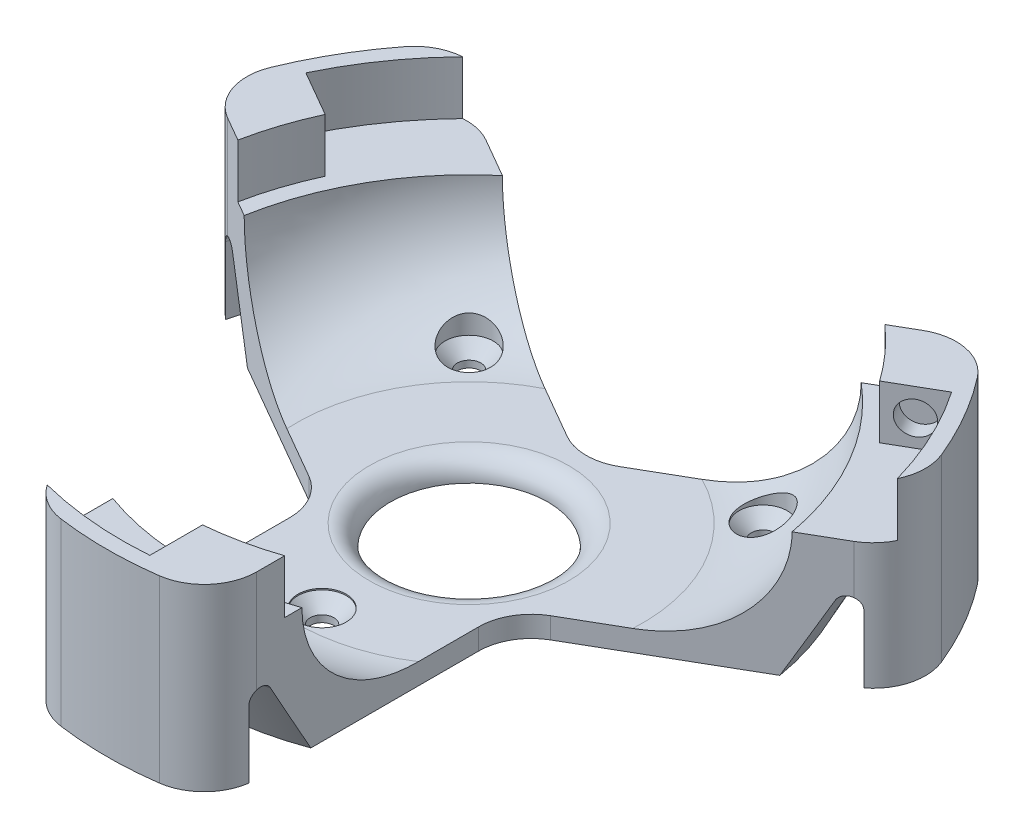
from build123d import *

# Parameters (mm, degrees)
SKETCH2_R                                      = 69
SKETCH2_R_2                                    = 53
BOSS_EXTRUDE1_DEPTH                            = 20
BOSS_EXTRUDE2_START                            = 4
SKETCH5_R                                      = 69
BOSS_EXTRUDE2_DEPTH                            = 4
CUT_EXTRUDE1_DEPTH                             = 101.488805371
CUT_EXTRUDE2_DEPTH                             = 10
CUT_EXTRUDE2_DEPTH_BACK                        = 0.25
SKETCH9_R                                      = 4.6
SKETCH15_R                                     = 15
CUT_EXTRUDE5_DEPTH                             = 12
FILLET1_R                                      = 10
FILLET2_R                                      = 10
FILLET4_R                                      = 4
CSK_FOR_M4_FLAT_HEAD_MACHINE_SCREW3_AT_2_COUNT = 2
CSK_FOR_M4_FLAT_HEAD_MACHINE_SCREW3_AT_2_PITCH = 62.60990337
CSK_FOR_M4_FLAT_HEAD_MACHINE_SCREW3_AT_3_COUNT = 2
CSK_FOR_M4_FLAT_HEAD_MACHINE_SCREW3_AT_3_PITCH = 62.60990337
BOSS_EXTRUDE3_DEPTH                            = 10.2
SKETCH17_R                                     = 3.1
CUT_EXTRUDE6_DEPTH                             = 3.1
CIRPATTERN1_COUNT                              = 3
FILLET5_R                                      = 2


with BuildPart() as part:
    # Sketch2 → Boss-Extrude1 (new body)
    with BuildSketch(Plane(origin=(0, 0, 0), x_dir=(1, 0, 0), z_dir=(0, 1, 0))):
        with Locations(Location((0, 0, 0), (0, 0, 270))):
            Circle(SKETCH2_R)
        with Locations(Location((0, 0, 0), (0, 0, 270))):
            Circle(SKETCH2_R_2, mode=Mode.SUBTRACT)
    extrude(amount=BOSS_EXTRUDE1_DEPTH)

    # Sketch4 → Revolve5 (revolve)
    with BuildSketch(Plane.XY):
        with BuildLine():
            Line((53, 20), (53, 0))
            Line((53, 0), (33, 0))
            add(Edge.make_bspline(
                [(33, 0), (53, 0), (53, 20)],
                knots=[4.71238898, 4.71238898, 4.71238898, 6.283185307, 6.283185307, 6.283185307], degree=2, weights=[1, 0.707106781, 1]))
        make_face()
    revolve(axis=Axis((0, 20, 0), (0, -1, 0)))

    # Sketch5 → Boss-Extrude2 (add)
    with BuildSketch(Plane.XZ.offset(BOSS_EXTRUDE2_START)):
        with Locations(Location((0, 0, 0), (0, 0, 270))):
            Circle(SKETCH5_R)
    extrude(amount=-BOSS_EXTRUDE2_DEPTH)

    # Sketch6 → Cut-Extrude1 (cut, through all)
    with BuildSketch(Plane.XZ.offset(4)):
        with BuildLine():
            Line((18, 10.392304845), (18, 58.283788484))
            Line((18, 58.283788484), (18, 89.35097408))
            ThreePointArc((18, 89.35097408), (78.934766908, 45.573008923), (86.380213406, -29.087029772))
            Line((86.380213406, -29.087029772), (59.475241456, -13.553436974))
            Line((59.475241456, -13.553436974), (18, 10.392304845))
        make_face()
        with BuildLine():
            Line((-59.475241456, -13.553436974), (-86.380213406, -29.087029772))
            ThreePointArc((-86.380213406, -29.087029772), (-78.934766908, 45.573008923), (-18, 89.35097408))
            Line((-18, 89.35097408), (-18, 58.283788484))
            Line((-18, 58.283788484), (-18, 10.392304845))
            Line((-18, 10.392304845), (-59.475241456, -13.553436974))
        make_face()
        with BuildLine():
            Line((0, -20.784609691), (41.475241456, -44.73035151))
            Line((41.475241456, -44.73035151), (68.380213406, -60.263944308))
            ThreePointArc((68.380213406, -60.263944308), (0, -91.146017845), (-68.380213406, -60.263944308))
            Line((-68.380213406, -60.263944308), (-41.475241456, -44.73035151))
            Line((-41.475241456, -44.73035151), (0, -20.784609691))
        make_face()
    extrude(amount=-CUT_EXTRUDE1_DEPTH, mode=Mode.SUBTRACT)

    # Sketch9 → Cut-Extrude2 (cut, two sides: drawn at the far end of the back side and taken through both)
    with BuildSketch(Plane(origin=(0, 0, 0), x_dir=(1, 0, 0), z_dir=(0, 1, 0)).offset(-CUT_EXTRUDE2_DEPTH_BACK)):
        with Locations(Location((0, -28, 0), (0, 0, 270))):
            Circle(SKETCH9_R)
        with Locations(Location((-28, 28, 0), (0, 0, 270))):
            Circle(SKETCH9_R)
        with Locations(Location((28, 28, 0), (0, 0, 270))):
            Circle(SKETCH9_R)
    extrude(amount=CUT_EXTRUDE2_DEPTH + CUT_EXTRUDE2_DEPTH_BACK, mode=Mode.SUBTRACT)

    # Sketch15 → Cut-Extrude5 (cut)
    with BuildSketch(Plane(origin=(0, 0, 0), x_dir=(1, 0, 0), z_dir=(0, 1, 0))):
        with Locations(Location((0, 0, 0), (0, 0, 270))):
            Circle(SKETCH15_R)
    extrude(amount=-CUT_EXTRUDE5_DEPTH, mode=Mode.SUBTRACT)

    # Fillet1
    fillet1_edges = [part.edges().sort_by_distance(p)[0] for p in [
        (-18, -2, 10.392304845),
        (0, -2, -20.784609691),
        (18, -2, 10.392304845),
    ]]
    fillet(fillet1_edges, radius=FILLET1_R)

    # Fillet2
    fillet2_edges = [part.edges().sort_by_distance(p)[0] for p in [
        (-66.686653569, 8, -17.716947699),
        (-18, 8, 66.610809934),
        (-48.686653569, 8, -48.893862235),
        (48.686653569, 8, -48.893862235),
        (66.686653569, 8, -17.716947699),
        (18, 8, 66.610809934),
    ]]
    fillet(fillet2_edges, radius=FILLET2_R)

    # Fillet4
    fillet4_edges = [part.edges().sort_by_distance(p)[0] for p in [
        (0, 0, -15),
    ]]
    fillet(fillet4_edges, radius=FILLET4_R - 0.0001)  # a hair under: the kernel refuses the full size

    # Sketch14 → CSK for M4 Flat Head Machine Screw3 (revolve, cut)
    with BuildSketch(Plane(origin=(0, -0.25, 28), x_dir=(0, 0, 1), z_dir=(1, 0, 0))):
        Polygon((0, 0), (0, 3.75), (2.25, 3.75), (2.25, 2.45), (4.7, 0), align=None)
    csk_for_m4_flat_head_machine_screw3 = revolve(axis=Axis((0, 6.1, 28), (0, -1, 0)), mode=Mode.SUBTRACT)

    # CSK for M4 Flat Head Machine Screw3 at 2: CSK for M4 Flat Head Machine Screw3 ×2
    with Locations(*[Vector(-0.44721359549996426, 0, -0.8944271909999127) * (i * CSK_FOR_M4_FLAT_HEAD_MACHINE_SCREW3_AT_2_PITCH) for i in range(1, CSK_FOR_M4_FLAT_HEAD_MACHINE_SCREW3_AT_2_COUNT)]):
        add(csk_for_m4_flat_head_machine_screw3, mode=Mode.SUBTRACT)

    # CSK for M4 Flat Head Machine Screw3 at 3: CSK for M4 Flat Head Machine Screw3 ×2
    with Locations(*[Vector(0.4472135954999541, 0, -0.8944271909999177) * (i * CSK_FOR_M4_FLAT_HEAD_MACHINE_SCREW3_AT_3_PITCH) for i in range(1, CSK_FOR_M4_FLAT_HEAD_MACHINE_SCREW3_AT_3_COUNT)]):
        add(csk_for_m4_flat_head_machine_screw3, mode=Mode.SUBTRACT)

    # Sketch16 → Boss-Extrude3 (add)
    with BuildSketch(Plane(origin=(0, 20, 0), x_dir=(1, 0, 0), z_dir=(0, 1, 0))):
        with BuildLine():
            Line((-59.623636646, 28.534749922), (-50.932848201, 23.517120873))
            ThreePointArc((-50.932848201, 23.517120873), (-53.343759453, 17.36816995), (-55.01529637, 10.978486478))
            Line((-55.01529637, 10.978486478), (-59.623611092, 13.639098223))
            ThreePointArc((-59.623611092, 13.639098223), (-64.084664671, 19.060762263), (-63.88185026, 26.078903492))
            ThreePointArc((-63.88185026, 26.078903492), (-59.755752861, 34.5), (-54.525918057, 42.28385342))
            ThreePointArc((-54.525918057, 42.28385342), (-51.343356134, 44.9718807), (-47.341720638, 46.129941329))
            ThreePointArc((-47.341720638, 46.129941329), (-54.201426226, 37.834050736), (-59.623636646, 28.534749922))
        make_face()
    boss_extrude3 = extrude(amount=BOSS_EXTRUDE3_DEPTH)

    # Sketch17 → Cut-Extrude6 (cut)
    with BuildSketch(Plane(origin=(-2.55, 0, 4.416729559), x_dir=(-0.8660254037844332, 0, -0.5000000000000097), z_dir=(0.5000000000000097, 0, -0.8660254037844332))):
        with Locations((60.867700866, 25)):
            Circle(SKETCH17_R)
    cut_extrude6 = extrude(amount=-CUT_EXTRUDE6_DEPTH, mode=Mode.SUBTRACT)

    # CirPattern1: Boss-Extrude3, Cut-Extrude6 ×3 about axis
    cirpattern1_axis = Axis((0, 0, 0), (0, 1, 0))
    add([boss_extrude3.rotate(cirpattern1_axis, i * 360 / CIRPATTERN1_COUNT) for i in range(1, CIRPATTERN1_COUNT)])
    add([cut_extrude6.rotate(cirpattern1_axis, i * 360 / CIRPATTERN1_COUNT) for i in range(1, CIRPATTERN1_COUNT)], mode=Mode.SUBTRACT)

    # Sketch18 → Cut-Revolve1 (revolve, cut)
    with BuildSketch(Plane(origin=(0, 0, 0), x_dir=(-0.8660254037844364, 0, -0.5000000000000041), z_dir=(0.5000000000000041, 0, -0.8660254037844364)), mode=Mode.PRIVATE) as cut_revolve1_sk:
        Polygon((62.455110983, -4), (62.455110983, 16.911455346), (51.395223764, -4), align=None)
    revolve(cut_revolve1_sk.sketch.rotate(Axis((0, 20, 0), (0, -1, 0)), 60), axis=Axis((0, 20, 0), (0, -1, 0)), mode=Mode.SUBTRACT)

    # Fillet5
    fillet5_edges = [part.edges().sort_by_distance(p)[0] for p in [
        (-54.087712707, 16.911455346, -31.227555491),
        (54.087712707, 16.911455346, -31.227555491),
        (0, 16.911455346, 62.455110983),
    ]]
    fillet(fillet5_edges, radius=FILLET5_R)


solid = part.part
